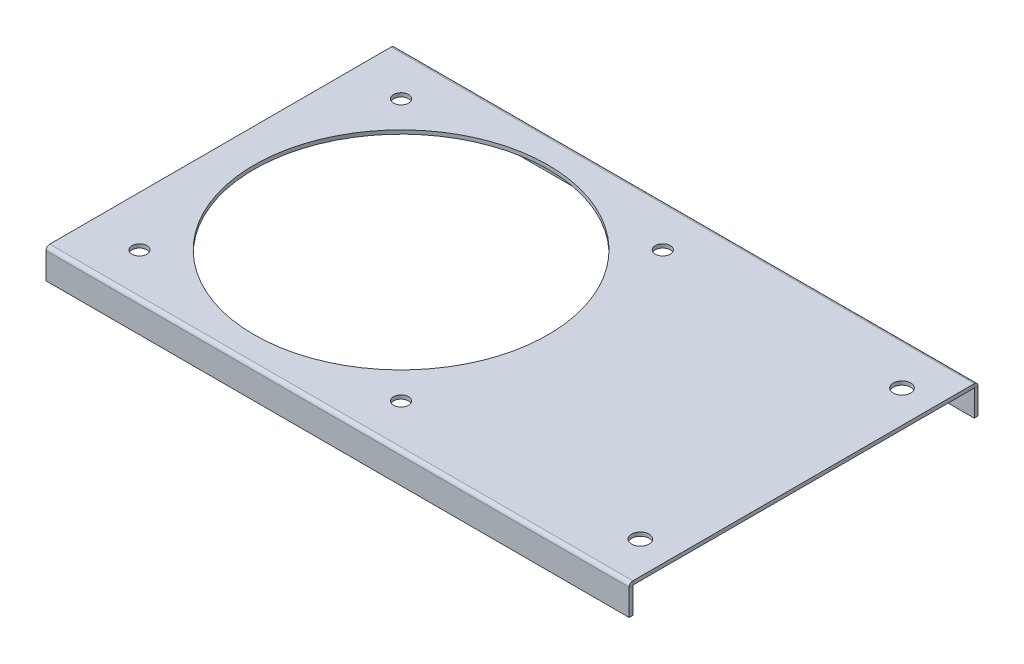
from build123d import *

# Parameters (mm, degrees)
SM_START               = -117
SM_BASE_FLANGE_1_DEPTH = 234
SKETCH_7_R             = 59
SKETCH_7_R_2           = 3
SKETCH_7_R_3           = 3.5
CUT_EXTRUDE_1_DEPTH    = 137.868550076


# Read off the part's stored shape, not the designer's step: 基体-法兰1
with BuildPart() as part:
    # 基体-法兰1 outline → 基体-法兰1 (new body)
    with BuildSketch(Plane(origin=(0, 0, 0), x_dir=(0, 0, -1), z_dir=(1, 0, 0)).offset(SM_START)):
        with BuildLine():
            Line((68.5, -1.5), (68.5, -12))
            Line((68.5, -12), (70, -12))
            Line((70, -12), (70, -1.5))
            ThreePointArc((70, -1.5), (69.560660172, -0.439339828), (68.5, 0))
            Line((68.5, 0), (-68.5, 0))
            ThreePointArc((-68.5, 0), (-69.560660172, -0.439339828), (-70, -1.5))
            Line((-70, -1.5), (-70, -12))
            Line((-70, -12), (-68.5, -12))
            Line((-68.5, -12), (-68.5, -1.5))
            Line((-68.5, -1.5), (68.5, -1.5))
        make_face()
    extrude(amount=SM_BASE_FLANGE_1_DEPTH)

    # 草图7 → 切除-拉伸1 (cut, through all)
    with BuildSketch(Plane(origin=(0, 0, 0), x_dir=(1, 0, 0), z_dir=(0, 1, 0))):
        with Locations(Location((-44.5, 0, 0), (0, 0, 270))):
            Circle(SKETCH_7_R)
        with Locations(Location((-97, 52.5, 0), (0, 0, 270))):
            Circle(SKETCH_7_R_2)
        with Locations(Location((8, 52.5, 0), (0, 0, 270))):
            Circle(SKETCH_7_R_2)
        with Locations(Location((8, -52.5, 0), (0, 0, 270))):
            Circle(SKETCH_7_R_2)
        with Locations(Location((-97, -52.5, 0), (0, 0, 270))):
            Circle(SKETCH_7_R_2)
        with Locations(Location((104, 52.5, 0), (0, 0, 270))):
            Circle(SKETCH_7_R_3)
        with Locations(Location((104, -52.5, 0), (0, 0, 270))):
            Circle(SKETCH_7_R_3)
    extrude(amount=-CUT_EXTRUDE_1_DEPTH, mode=Mode.SUBTRACT)


solid = part.part
